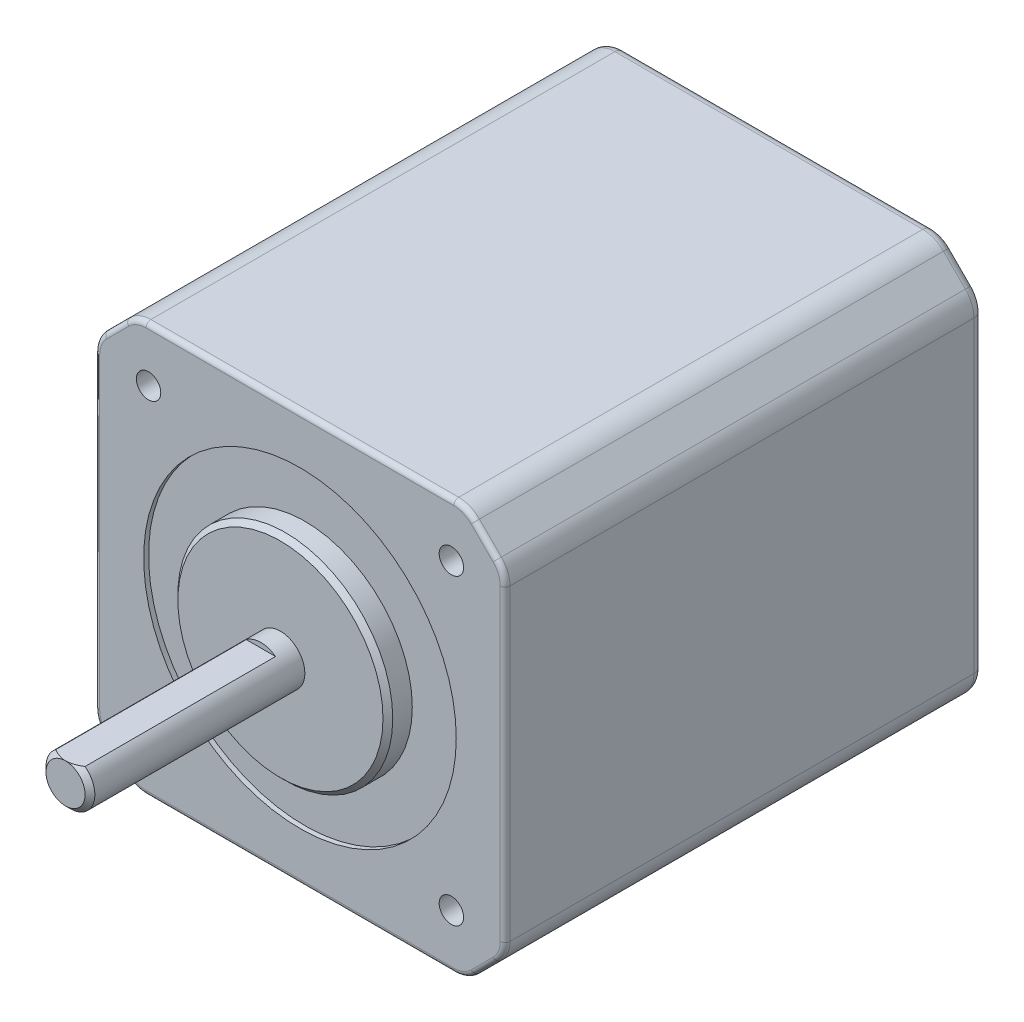
from build123d import *

# Parameters (mm, degrees)
SKETCH1_W           = 42
SKETCH1_H           = 42
BOSS_EXTRUDE1_DEPTH = 24.5
CHAMFER1_SIZE       = 4
SKETCH2_R           = 11
BOSS_EXTRUDE2_DEPTH = 2
CUT_EXTRUDE1_START  = -0.5
SKETCH3_R           = 16
SKETCH3_R_2         = 11
CUT_EXTRUDE1_DEPTH  = 0.5
SKETCH4_R           = 2.5
BOSS_EXTRUDE3_DEPTH = 22
SKETCH5_W           = 10.364275964
SKETCH5_H           = 1.526028363
CUT_EXTRUDE2_DEPTH  = 20
CIRPATTERN1_COUNT   = 4
FILLET1_R           = 3
CHAMFER2_SIZE       = 0.5
FILLET2_R           = 1
FILLET3_R           = 0.5
SKETCH8_R           = 0.65
BOSS_EXTRUDE4_DEPTH = 2
SKETCH9_R           = 3.5
CUT_EXTRUDE3_DEPTH  = 3.5
BOSS_EXTRUDE5_START = 18.5
SKETCH10_R          = 2.5
BOSS_EXTRUDE5_DEPTH = 18.5
CUT_EXTRUDE4_DEPTH  = 14
CHAMFER3_SIZE       = 0.5


with BuildPart() as part:
    # Sketch1 → Boss-Extrude1 (new, symmetric)
    with BuildSketch(Plane.XY):
        Rectangle(SKETCH1_W, SKETCH1_H)
    extrude(amount=BOSS_EXTRUDE1_DEPTH, both=True)

    # Chamfer1
    chamfer1_edges = [part.edges().sort_by_distance(p)[0] for p in [
        (21, -21, 0),
        (-21, -21, 0),
        (-21, 21, 0),
        (21, 21, 0),
    ]]
    chamfer(chamfer1_edges, length=CHAMFER1_SIZE)

    # Sketch2 → Boss-Extrude2 (add)
    with BuildSketch(Plane.XY.offset(24.5)):
        with Locations(Location((0, 0, 0), (0, 0, 180))):
            Circle(SKETCH2_R)
    extrude(amount=BOSS_EXTRUDE2_DEPTH)

    # Sketch3 → Cut-Extrude1 (cut)
    with BuildSketch(Plane.XY.offset(24.5).offset(CUT_EXTRUDE1_START)):
        Circle(SKETCH3_R)
        Circle(SKETCH3_R_2, mode=Mode.SUBTRACT)
    extrude(amount=CUT_EXTRUDE1_DEPTH, mode=Mode.SUBTRACT)

    # Sketch4 → Boss-Extrude3 (add)
    with BuildSketch(Plane.XY.offset(26.5)):
        Circle(SKETCH4_R)
    extrude(amount=BOSS_EXTRUDE3_DEPTH)

    # Sketch5 → Cut-Extrude2 (cut)
    with BuildSketch(Plane.XY.offset(48.5)):
        with Locations((0.738499094, 2.763014181)):
            Rectangle(SKETCH5_W, SKETCH5_H)
    extrude(amount=-CUT_EXTRUDE2_DEPTH, mode=Mode.SUBTRACT)

    # Sketch7 → M3x0.5 Tapped Hole1 (revolve, cut)
    with BuildSketch(Plane(origin=(-15.5, 15.5, 24.5), x_dir=(0, -1, 0), z_dir=(1, 0, 0))):
        Polygon((0, 0), (0, 8.251075774), (1.25, 7.5), (1.25, 0), align=None)
    m3x0_5_tapped_hole1 = revolve(axis=Axis((-15.5, 15.5, 30.85), (0, 0, -1)), mode=Mode.SUBTRACT)

    # CirPattern1: M3x0.5 Tapped Hole1 ×4 about axis
    cirpattern1_axis = Axis((0, 0, 0), (0, 0, 1))
    for i in range(1, CIRPATTERN1_COUNT):
        add(m3x0_5_tapped_hole1.rotate(cirpattern1_axis, i * 360 / CIRPATTERN1_COUNT), mode=Mode.SUBTRACT)

    # Fillet1
    fillet1_edges = [part.edges().sort_by_distance(p)[0] for p in [
        (17, -21, 0),
        (-17, -21, 0),
        (-21, 17, 0),
        (-21, -17, 0),
        (21, 17, 0),
        (21, -17, 0),
        (17, 21, 0),
        (-17, 21, 0),
    ]]
    fillet(fillet1_edges, radius=FILLET1_R)

    # Chamfer2
    chamfer2_edges = [part.edges().sort_by_distance(p)[0] for p in [
        (-1.118033989, -2.236067977, 48.5),
        (11, 0, 26.5),
    ]]
    chamfer(chamfer2_edges, length=CHAMFER2_SIZE - 0.0001)  # a hair under: the kernel refuses the full size

    # Fillet2
    fillet2_edges = [part.edges().sort_by_distance(p)[0] for p in [
        (-19, -19, -24.5),
        (0, -21, -24.5),
        (-19, 19, -24.5),
        (0, 21, -24.5),
        (19, 19, -24.5),
        (21, 0, -24.5),
        (19, -19, -24.5),
        (-16.90540961, 20.771638598, -24.5),
        (-20.771638598, 16.90540961, -24.5),
        (16.90540961, 20.771638598, -24.5),
        (20.771638598, 16.90540961, -24.5),
        (20.771638598, -16.90540961, -24.5),
        (16.90540961, -20.771638598, -24.5),
        (-16.90540961, -20.771638598, -24.5),
        (-20.771638598, -16.90540961, -24.5),
        (-21, 0, -24.5),
    ]]
    fillet(fillet2_edges, radius=FILLET2_R)

    # Fillet3
    fillet3_edges = [part.edges().sort_by_distance(p)[0] for p in [
        (-16.90540961, 20.771638598, 24.5),
        (-20.771638598, 16.90540961, 24.5),
        (16.90540961, 20.771638598, 24.5),
        (20.771638598, 16.90540961, 24.5),
        (20.771638598, -16.90540961, 24.5),
        (16.90540961, -20.771638598, 24.5),
        (-16.90540961, -20.771638598, 24.5),
        (-20.771638598, -16.90540961, 24.5),
        (-21, 0, 24.5),
        (-19, -19, 24.5),
        (0, -21, 24.5),
        (19, -19, 24.5),
        (21, 0, 24.5),
        (19, 19, 24.5),
        (0, 21, 24.5),
        (-19, 19, 24.5),
    ]]
    fillet(fillet3_edges, radius=FILLET3_R)

    # Sketch8 → Boss-Extrude4 (add)
    with BuildSketch(Plane.XZ.offset(21)):
        with Locations(Location((0, -18.574359193, 0), (0, 0, 90))):
            Circle(SKETCH8_R)
        with Locations(Location((1.158492333, -19.5, 0), (0, 0, 90))):
            Circle(SKETCH8_R)
        with Locations(Location((0.032430158, -20.352099903, 0), (0, 0, 90))):
            Circle(SKETCH8_R)
        with Locations(Location((-1.136757802, -19.5, 0), (0, 0, 90))):
            Circle(SKETCH8_R)
    extrude(amount=BOSS_EXTRUDE4_DEPTH)

    # Sketch9 → Cut-Extrude3 (cut)
    with BuildSketch(Plane(origin=(0, 0, -24.5), x_dir=(-1, 0, 0), z_dir=(0, 0, -1))):
        Circle(SKETCH9_R)
    extrude(amount=-CUT_EXTRUDE3_DEPTH, mode=Mode.SUBTRACT)

    # Sketch10 → Boss-Extrude5 (add)
    with BuildSketch(Plane(origin=(0, 0, -21), x_dir=(-1, 0, 0), z_dir=(0, 0, -1)).offset(BOSS_EXTRUDE5_START)):
        with Locations(Location((0, 0, 0), (0, 0, 53.130102354))):
            Circle(SKETCH10_R)
    extrude(amount=-BOSS_EXTRUDE5_DEPTH)

    # Sketch11 → Cut-Extrude4 (cut)
    with BuildSketch(Plane(origin=(0, 0, -39.5), x_dir=(-1, 0, 0), z_dir=(0, 0, -1))):
        Polygon((-2.474861219, 1.965641899), (2.844080947, 2.039902832), (0.230053947, 6.606484891), align=None)
    extrude(amount=-CUT_EXTRUDE4_DEPTH, mode=Mode.SUBTRACT)

    # Chamfer3
    chamfer3_edges = [part.edges().sort_by_distance(p)[0] for p in [
        (-0.017450722, -2.499939094, -39.5),
    ]]
    chamfer(chamfer3_edges, length=CHAMFER3_SIZE - 0.0001)  # a hair under: the kernel refuses the full size


solid = part.part
